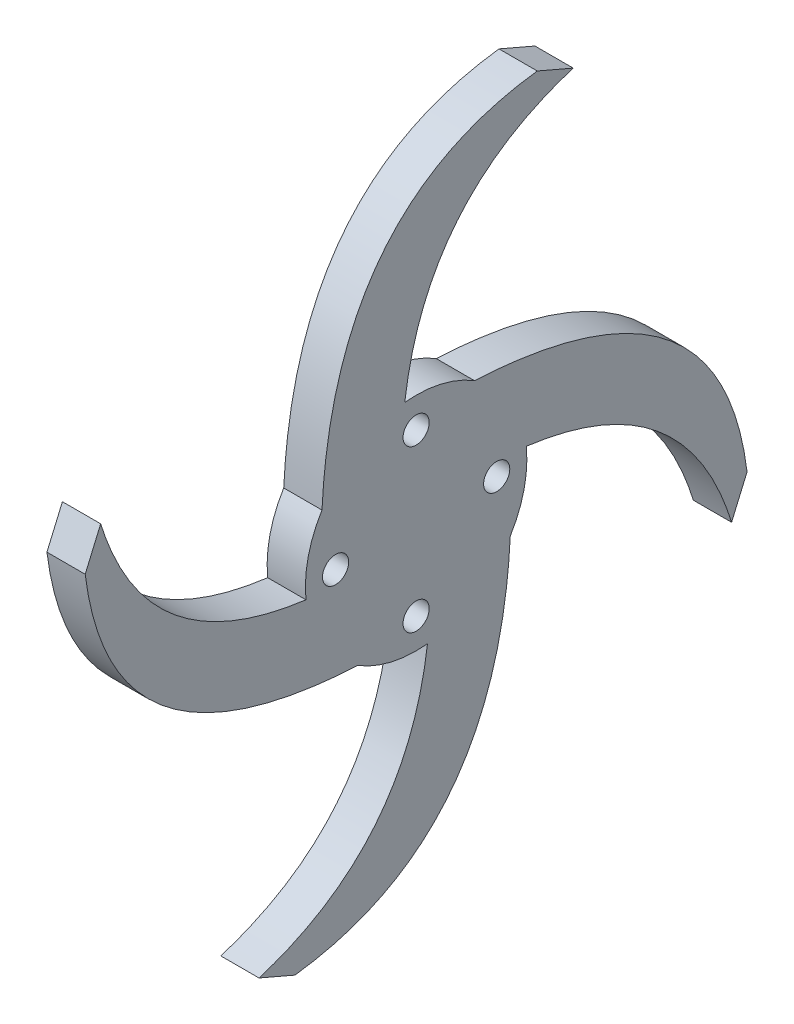
from build123d import *

# Parameters (mm, degrees)
SKETCH1_R           = 13.97
SKETCH1_R_2         = 1.651
BOSS_EXTRUDE1_DEPTH = 4.826
LEG1_DEPTH          = 4.826


with BuildPart() as part:
    # Sketch1 → Boss-Extrude1 (new body)
    with BuildSketch(Plane(origin=(0, 0, 0), x_dir=(0, 0, -1), z_dir=(1, 0, 0))):
        Circle(SKETCH1_R)
        with Locations((-10.16, 0)):
            Circle(SKETCH1_R_2, mode=Mode.SUBTRACT)
        with Locations((0, 10.16)):
            Circle(SKETCH1_R_2, mode=Mode.SUBTRACT)
        with Locations((10.16, 0)):
            Circle(SKETCH1_R_2, mode=Mode.SUBTRACT)
        with Locations((0, -10.16)):
            Circle(SKETCH1_R_2, mode=Mode.SUBTRACT)
    extrude(amount=BOSS_EXTRUDE1_DEPTH)

    # Sketch2 → leg1 (add)
    with BuildSketch(Plane(origin=(4.826, 0, 0), x_dir=(0, 0, -1), z_dir=(1, 0, 0))):
        with BuildLine():
            Line((15.277980944, 41.741895001), (19.813737669, 39.789675791))
            add(Edge.make_bspline(
                [(-1.435242993, 13.896077776), (1.164409296, 34.004361511), (19.813737669, 39.789675791)],
                knots=[0, 0, 0, 1, 1, 1], degree=2))
            Line((-1.435242993, 13.896077776), (-11.875320835, 7.357829508))
            add(Edge.make_bspline(
                [(-11.875320835, 7.357829508), (-10.285248522, 38.547773029), (15.277980944, 41.741895001)],
                knots=[0, 0, 0, 1, 1, 1], degree=2))
        make_face()
        with BuildLine():
            Line((7.357829508, 11.875320835), (13.896077776, 1.435242993))
            add(Edge.make_bspline(
                [(13.896077776, 1.435242993), (34.004361511, -1.164409296), (39.789675791, -19.813737669)],
                knots=[0, 0, 0, 1, 1, 1], degree=2))
            Line((39.789675791, -19.813737669), (41.741895001, -15.277980944))
            add(Edge.make_bspline(
                [(7.357829508, 11.875320835), (38.547773029, 10.285248522), (41.741895001, -15.277980944)],
                knots=[0, 0, 0, 1, 1, 1], degree=2))
        make_face()
        with BuildLine():
            Line((11.875320835, -7.357829508), (1.435242993, -13.896077776))
            add(Edge.make_bspline(
                [(1.435242993, -13.896077776), (-1.164409296, -34.004361511), (-19.813737669, -39.789675791)],
                knots=[0, 0, 0, 1, 1, 1], degree=2))
            Line((-19.813737669, -39.789675791), (-15.277980944, -41.741895001))
            add(Edge.make_bspline(
                [(11.875320835, -7.357829508), (10.285248522, -38.547773029), (-15.277980944, -41.741895001)],
                knots=[0, 0, 0, 1, 1, 1], degree=2))
        make_face()
        with BuildLine():
            Line((-7.357829508, -11.875320835), (-13.896077776, -1.435242993))
            add(Edge.make_bspline(
                [(-13.896077776, -1.435242993), (-34.004361511, 1.164409296), (-39.789675791, 19.813737669)],
                knots=[0, 0, 0, 1, 1, 1], degree=2))
            Line((-39.789675791, 19.813737669), (-41.741895001, 15.277980944))
            add(Edge.make_bspline(
                [(-7.357829508, -11.875320835), (-38.547773029, -10.285248522), (-41.741895001, 15.277980944)],
                knots=[0, 0, 0, 1, 1, 1], degree=2))
        make_face()
    extrude(amount=-LEG1_DEPTH)


solid = part.part
